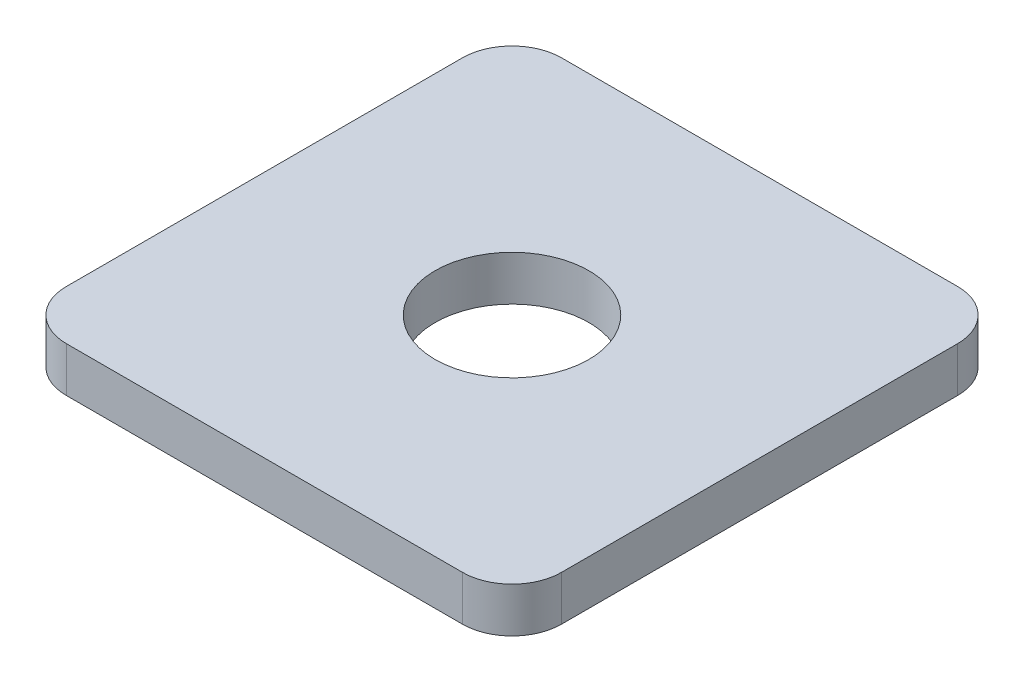
from build123d import *

# Parameters (mm, degrees)
BOSS_EXTRUDE1_DEPTH = 6.35
SKETCH2_R           = 10.875
CUT_EXTRUDE1_DEPTH  = 6.35


with BuildPart() as part:
    # Sketch1 → Boss-Extrude1 (new body)
    with BuildSketch(Plane(origin=(0, 0, 0), x_dir=(1, 0, 0), z_dir=(0, 1, 0))):
        with BuildLine():
            Line((7, 0), (63, 0))
            ThreePointArc((63, 0), (67.949747468, 2.050252532), (70, 7))
            Line((70, 7), (70, 63))
            ThreePointArc((70, 63), (67.949747468, 67.949747468), (63, 70))
            Line((63, 70), (7, 70))
            ThreePointArc((7, 70), (2.050252532, 67.949747468), (0, 63))
            Line((0, 63), (0, 7))
            ThreePointArc((0, 7), (2.050252532, 2.050252532), (7, 0))
        make_face()
    extrude(amount=BOSS_EXTRUDE1_DEPTH)

    # Sketch2 → Cut-Extrude1 (cut)
    with BuildSketch(Plane(origin=(0, 6.35, 0), x_dir=(1, 0, 0), z_dir=(0, 1, 0))):
        with Locations((35, 35)):
            Circle(SKETCH2_R)
    extrude(amount=-CUT_EXTRUDE1_DEPTH, mode=Mode.SUBTRACT)


solid = part.part
